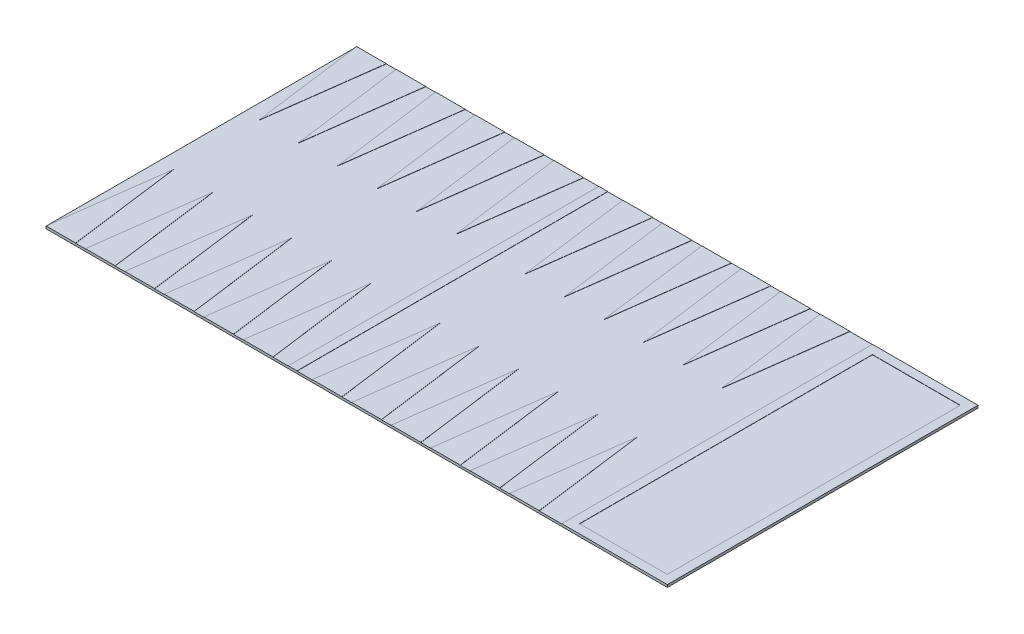
from build123d import *

# Parameters (mm, degrees)
SKETCH1_W           = 700
SKETCH1_H           = 350
BOSS_EXTRUDE1_DEPTH = 2.54
SKETCH2_W           = 10
SKETCH2_H           = 350
SKETCH2_W_2         = 118.936265613
SKETCH2_W_3         = 98.936265613
SKETCH2_H_2         = 330
BOSS_EXTRUDE2_DEPTH = 0.254


with BuildPart() as part:
    # Sketch1 → Boss-Extrude1 (new body)
    with BuildSketch(Plane(origin=(0, 0, 0), x_dir=(1, 0, 0), z_dir=(0, 1, 0))):
        Rectangle(SKETCH1_W, SKETCH1_H)
    extrude(amount=BOSS_EXTRUDE1_DEPTH)

    # Sketch2 → Boss-Extrude2 (add)
    # profile 1 of 26: a face of its own
    with BuildSketch(Plane(origin=(0, 2.54, 0), x_dir=(1, 0, 0), z_dir=(0, 1, 0))):
        Polygon((-316.560265613, 175), (-350, 175), (-333.280132806, 48), align=None)
    # profile 2 of 26: a face of its own
    with BuildSketch(Plane(origin=(0, 2.54, 0), x_dir=(1, 0, 0), z_dir=(0, 1, 0))):
        Polygon((-350, -175), (-316.560265613, -175), (-333.280132806, -48), align=None)
    # profile 3 of 26: a face of its own
    with BuildSketch(Plane(origin=(0, 2.54, 0), x_dir=(1, 0, 0), z_dir=(0, 1, 0))):
        Polygon((-305.55, -175), (-272.110265613, -175), (-288.830132806, -48), align=None)
    # profile 4 of 26: a face of its own
    with BuildSketch(Plane(origin=(0, 2.54, 0), x_dir=(1, 0, 0), z_dir=(0, 1, 0))):
        Polygon((-261.1, -175), (-227.660265613, -175), (-244.380132806, -48), align=None)
    # profile 5 of 26: a face of its own
    with BuildSketch(Plane(origin=(0, 2.54, 0), x_dir=(1, 0, 0), z_dir=(0, 1, 0))):
        Polygon((-216.65, -175), (-183.210265613, -175), (-199.930132806, -48), align=None)
    # profile 6 of 26: a face of its own
    with BuildSketch(Plane(origin=(0, 2.54, 0), x_dir=(1, 0, 0), z_dir=(0, 1, 0))):
        Polygon((-172.2, -175), (-138.760265613, -175), (-155.480132806, -48), align=None)
    # profile 7 of 26: a face of its own
    with BuildSketch(Plane(origin=(0, 2.54, 0), x_dir=(1, 0, 0), z_dir=(0, 1, 0))):
        Polygon((-127.75, -175), (-94.310265613, -175), (-111.030132806, -48), align=None)
    # profile 8 of 26: a face of its own
    with BuildSketch(Plane(origin=(0, 2.54, 0), x_dir=(1, 0, 0), z_dir=(0, 1, 0))):
        with Locations((-72.168132806, 0)):
            Rectangle(SKETCH2_W, SKETCH2_H)
    # profile 9 of 26: a face of its own
    with BuildSketch(Plane(origin=(0, 2.54, 0), x_dir=(1, 0, 0), z_dir=(0, 1, 0))):
        Polygon((-94.310265613, 175), (-127.75, 175), (-111.030132806, 48), align=None)
    # profile 10 of 26: a face of its own
    with BuildSketch(Plane(origin=(0, 2.54, 0), x_dir=(1, 0, 0), z_dir=(0, 1, 0))):
        Polygon((-138.760265613, 175), (-172.2, 175), (-155.480132806, 48), align=None)
    # profile 11 of 26: a face of its own
    with BuildSketch(Plane(origin=(0, 2.54, 0), x_dir=(1, 0, 0), z_dir=(0, 1, 0))):
        Polygon((-183.210265613, 175), (-216.65, 175), (-199.930132806, 48), align=None)
    # profile 12 of 26: a face of its own
    with BuildSketch(Plane(origin=(0, 2.54, 0), x_dir=(1, 0, 0), z_dir=(0, 1, 0))):
        Polygon((-227.660265613, 175), (-261.1, 175), (-244.380132806, 48), align=None)
    # profile 13 of 26: a face of its own
    with BuildSketch(Plane(origin=(0, 2.54, 0), x_dir=(1, 0, 0), z_dir=(0, 1, 0))):
        Polygon((-272.110265613, 175), (-305.55, 175), (-288.830132806, 48), align=None)
    # profile 14 of 26: a face of its own
    with BuildSketch(Plane(origin=(0, 2.54, 0), x_dir=(1, 0, 0), z_dir=(0, 1, 0))):
        Polygon((-16.586265613, 175), (-50.026, 175), (-33.306132806, 48), align=None)
    # profile 15 of 26: a face of its own
    with BuildSketch(Plane(origin=(0, 2.54, 0), x_dir=(1, 0, 0), z_dir=(0, 1, 0))):
        Polygon((-33.306132806, -48), (-50.026, -175), (-16.586265613, -175), align=None)
    # profile 16 of 26: a face of its own
    with BuildSketch(Plane(origin=(0, 2.54, 0), x_dir=(1, 0, 0), z_dir=(0, 1, 0))):
        Polygon((27.863734387, 175), (-5.576, 175), (11.143867194, 48), align=None)
    # profile 17 of 26: a face of its own
    with BuildSketch(Plane(origin=(0, 2.54, 0), x_dir=(1, 0, 0), z_dir=(0, 1, 0))):
        Polygon((11.143867194, -48), (-5.576, -175), (27.863734387, -175), align=None)
    # profile 18 of 26: a face of its own
    with BuildSketch(Plane(origin=(0, 2.54, 0), x_dir=(1, 0, 0), z_dir=(0, 1, 0))):
        Polygon((72.313734387, 175), (38.874, 175), (55.593867194, 48), align=None)
    # profile 19 of 26: a face of its own
    with BuildSketch(Plane(origin=(0, 2.54, 0), x_dir=(1, 0, 0), z_dir=(0, 1, 0))):
        Polygon((55.593867194, -48), (38.874, -175), (72.313734387, -175), align=None)
    # profile 20 of 26: a face of its own
    with BuildSketch(Plane(origin=(0, 2.54, 0), x_dir=(1, 0, 0), z_dir=(0, 1, 0))):
        Polygon((116.763734387, 175), (83.324, 175), (100.043867194, 48), align=None)
    # profile 21 of 26: a face of its own
    with BuildSketch(Plane(origin=(0, 2.54, 0), x_dir=(1, 0, 0), z_dir=(0, 1, 0))):
        Polygon((100.043867194, -48), (83.324, -175), (116.763734387, -175), align=None)
    # profile 22 of 26: a face of its own
    with BuildSketch(Plane(origin=(0, 2.54, 0), x_dir=(1, 0, 0), z_dir=(0, 1, 0))):
        Polygon((161.213734387, 175), (127.774, 175), (144.493867194, 48), align=None)
    # profile 23 of 26: a face of its own
    with BuildSketch(Plane(origin=(0, 2.54, 0), x_dir=(1, 0, 0), z_dir=(0, 1, 0))):
        Polygon((144.493867194, -48), (127.774, -175), (161.213734387, -175), align=None)
    # profile 24 of 26: a face of its own
    with BuildSketch(Plane(origin=(0, 2.54, 0), x_dir=(1, 0, 0), z_dir=(0, 1, 0))):
        Polygon((205.663734387, 175), (172.224, 175), (188.943867194, 48), align=None)
    # profile 25 of 26: a face of its own
    with BuildSketch(Plane(origin=(0, 2.54, 0), x_dir=(1, 0, 0), z_dir=(0, 1, 0))):
        Polygon((188.943867194, -48), (172.224, -175), (205.663734387, -175), align=None)
    # profile 26 of 26: a face of its own
    with BuildSketch(Plane(origin=(0, 2.54, 0), x_dir=(1, 0, 0), z_dir=(0, 1, 0))):
        with Locations((290.531867194, 0)):
            Rectangle(SKETCH2_W_2, SKETCH2_H)
        with Locations((290.531867194, 0)):
            Rectangle(SKETCH2_W_3, SKETCH2_H_2, mode=Mode.SUBTRACT)
    extrude(amount=BOSS_EXTRUDE2_DEPTH)


solid = part.part
